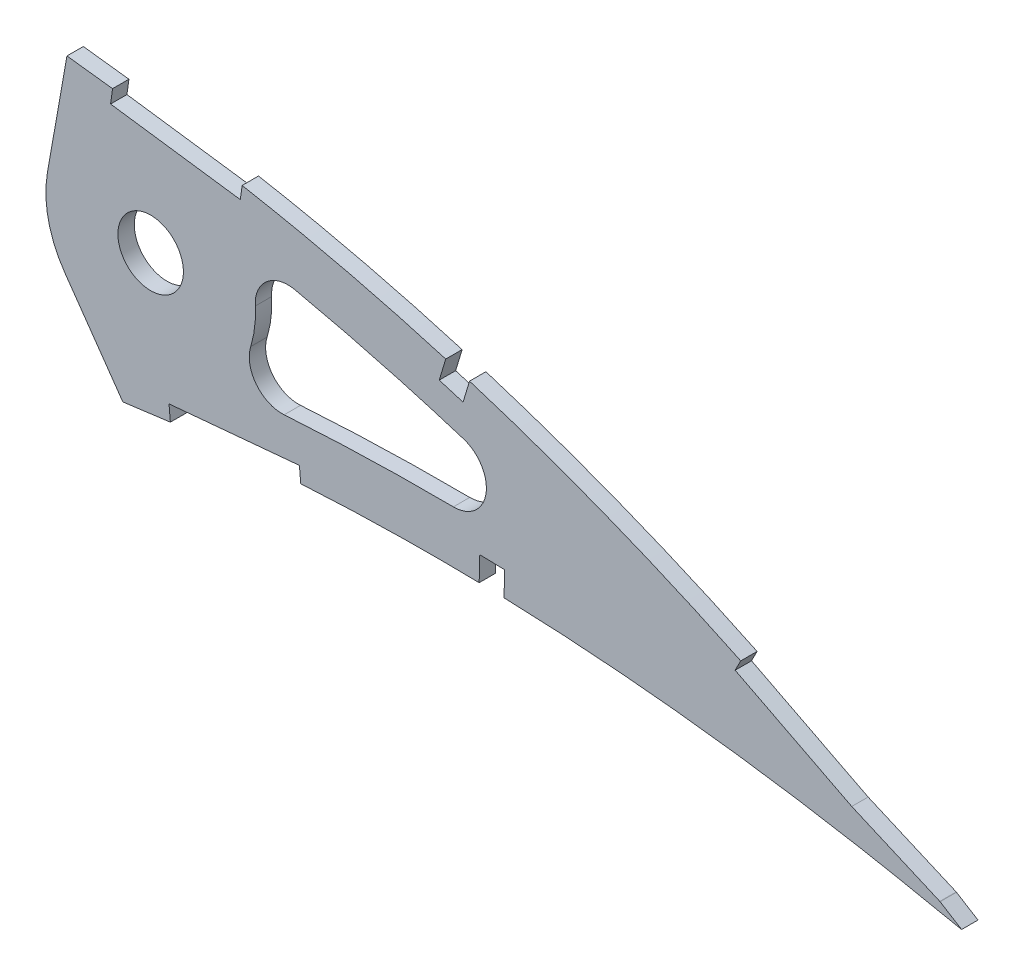
from build123d import *

# Parameters (mm, degrees)
BOSS_EXTRUDE1_DEPTH = 3.175
SKETCH4_R           = 6.35
CUT_EXTRUDE3_DEPTH  = 529.531996169
CUT_EXTRUDE4_DEPTH  = 7.62
FILLET1_R           = 6.35


with BuildPart() as part:
    # Sketch1 → Boss-Extrude1 (new body)
    with BuildSketch(Plane.XY):
        with BuildLine():
            Line((519.580178516, -0.811051185), (524.404942797, -1.768650656))
            Line((524.404942797, -1.768650656), (520.229019484, 0.811051185))
            add(Edge.make_bspline(
                [(520.229019484, 0.811051185), (520.189166605, 0.835670541), (520.029909792, 0.934052399), (519.671075297, 1.154156729), (519.073541109, 1.52075127), (518.237045599, 2.031290225), (517.162238007, 2.684417324), (515.848577801, 3.475559373), (514.296885216, 4.402146321), (512.507535633, 5.459795421), (510.480712337, 6.64355473), (508.21718701, 7.948628257), (505.717156954, 9.367627965), (502.981590452, 10.894755239), (500.011426026, 12.522747531), (496.807225449, 14.244251548), (493.37013628, 16.050511122), (489.701477824, 17.933756977), (485.801919013, 19.88358962), (481.673298347, 21.891894303), (477.316991217, 23.948657398), (472.734484625, 26.042905917), (467.928411224, 28.166102482), (462.900099753, 30.30504754), (457.652415647, 32.45047346), (452.187593096, 34.590170691), (446.508867721, 36.714394111), (440.618430338, 38.809382682), (434.52068427, 40.865980983), (428.218587641, 42.870829), (421.71664718, 44.813038248), (415.018640596, 46.680016502), (408.130151416, 48.4621889), (401.05554842, 50.146576673), (393.800827801, 51.721905645), (386.37175624, 53.178690862), (378.7745642, 54.502388693), (371.03030434, 55.691966852), (363.263579962, 56.681494561), (355.512835044, 57.651994424), (347.773632806, 58.563690257), (339.939841334, 59.436765181), (332.018997168, 60.266303487), (324.018957152, 61.049711288), (315.947820171, 61.783607472), (307.813973652, 62.465839869), (299.625288266, 63.092542591), (291.390398495, 63.662750235), (283.117445562, 64.171449818), (274.815241205, 64.618259557), (266.492213302, 65.000063177), (258.157023363, 65.314229919), (249.818522106, 65.558863312), (241.485365181, 65.731619671), (233.166575282, 65.831412809), (224.870805251, 65.855515939), (216.607073574, 65.803497941), (208.384033719, 65.673572684), (200.210713382, 65.463961556), (192.095777843, 65.174273359), (184.048002143, 64.804633746), (176.076197788, 64.351947189), (168.189012741, 63.819098613), (160.39523005, 63.203849575), (152.703412853, 62.5060365), (145.121622257, 61.728568125), (137.65829938, 60.86932984), (130.321442651, 59.930766435), (123.119077117, 58.914718085), (116.059284027, 57.820631377), (109.149625996, 56.651666482), (102.397560522, 55.409019412), (95.81023125, 54.096333304), (89.394810054, 52.713950514), (83.158087983, 51.266017865), (77.106546628, 49.75505799), (71.246691254, 48.18383703), (65.58446207, 46.556125144), (60.125584795, 44.875615234), (54.876423204, 43.144153764), (49.840944503, 41.368305654), (45.025334256, 39.549331576), (40.433281375, 37.692835265), (36.070167381, 35.80135162), (31.939251719, 33.880646801), (28.045209615, 31.932907511), (24.39081638, 29.963590665), (20.979740738, 27.975715944), (17.815266227, 25.972975661), (14.898722839, 23.96044987), (12.234131686, 21.939401784), (9.822408113, 19.914938493), (7.665078309, 17.890142748), (5.765226023, 15.866409302), (4.122782784, 13.847302025), (2.739901149, 11.834419923), (1.61682102, 9.829667672), (0.75608259, 7.834501578), (0.156832386, 5.85004365), (-0.171193188, 3.879222922), (-0.252840734, 1.920459398), (-0.084154315, 0.639196632), (0, 0)],
                knots=[0, 0, 0, 0, 0.00025409, 0.001015373, 0.002283359, 0.004056577, 0.006330982, 0.009105275, 0.012374489, 0.016134023, 0.02037966, 0.025105976, 0.030306237, 0.035972206, 0.042099522, 0.048678064, 0.055701664, 0.063160184, 0.071045824, 0.079349826, 0.08806291, 0.097175757, 0.106678112, 0.116561573, 0.126814276, 0.1374283, 0.148393618, 0.15969976, 0.171338126, 0.183297699, 0.195569604, 0.208143556, 0.221011593, 0.234161831, 0.24758745, 0.261276822, 0.27522271, 0.289414144, 0.3037712, 0.317689227, 0.331784111, 0.346039677, 0.36044387, 0.374982721, 0.389640455, 0.404403317, 0.419256601, 0.434186749, 0.449177265, 0.464214782, 0.479284009, 0.49436974, 0.509457833, 0.524532346, 0.53957932, 0.554582984, 0.569529546, 0.584403417, 0.599190992, 0.613876838, 0.628447475, 0.642888675, 0.657186054, 0.671325546, 0.685294014, 0.699078147, 0.712665095, 0.726042645, 0.739197713, 0.752117586, 0.764792042, 0.777208152, 0.789355685, 0.80122396, 0.812803686, 0.824082909, 0.835054602, 0.845709571, 0.856037853, 0.866033834, 0.875688843, 0.884997719, 0.893953426, 0.902552897, 0.910789386, 0.918660734, 0.926166253, 0.933302626, 0.94007122, 0.94647478, 0.952517526, 0.958204819, 0.963546652, 0.9685566, 0.973249913, 0.977651041, 0.981787043, 0.985694226, 0.989415109, 0.993001157, 0.996508416, 1, 1, 1, 1], degree=3))
            add(Edge.make_bspline(
                [(0, 0), (0.133592971, -0.630647919), (0.401392883, -1.8948421), (1.12897029, -3.714757932), (2.091156676, -5.464224213), (3.308146123, -7.138593951), (4.771846833, -8.737409521), (6.479026026, -10.262333902), (8.42800953, -11.712547121), (10.616246406, -13.087389262), (13.040557967, -14.388319695), (15.69821927, -15.614529628), (18.58680706, -16.765635887), (21.703174164, -17.840099654), (25.043510698, -18.839557444), (28.604640883, -19.761573512), (32.382515332, -20.607436647), (36.373500457, -21.374987622), (40.573247311, -22.065006311), (44.977392966, -22.677106427), (49.581416855, -23.211670923), (54.380802091, -23.667578066), (59.370801609, -24.045808466), (64.546441805, -24.346612989), (69.902698778, -24.570945614), (75.434441794, -24.717953346), (81.136253147, -24.789928223), (87.002979994, -24.787950681), (93.028883282, -24.711491768), (99.208815464, -24.564775433), (105.536846201, -24.346872236), (112.007262561, -24.060419153), (118.614228145, -23.708298892), (125.351817225, -23.291705179), (132.214100493, -22.812484346), (139.195119589, -22.274479418), (146.288532921, -21.679032497), (153.488154076, -21.029614162), (160.787609185, -20.329475604), (168.180591644, -19.580832593), (175.660575836, -18.787206853), (183.220899465, -17.951170059), (190.855131019, -17.077182461), (198.556296664, -16.166825422), (206.317884213, -15.225296547), (214.132591981, -14.254394805), (221.993885293, -13.257859815), (229.894693671, -12.240383742), (237.827620604, -11.201850487), (245.785993956, -10.149659277), (253.762138918, -9.082943465), (261.749112783, -8.007189221), (269.739522148, -6.925740253), (277.725584215, -5.838929488), (285.70027901, -4.751260828), (293.656208576, -3.665720235), (301.585579958, -2.582406874), (309.481219182, -1.506705212), (317.335175518, -0.438483792), (325.140206955, 0.620091626), (332.888833934, 1.665861231), (340.573746099, 2.697505345), (348.187015915, 3.714371056), (355.720983847, 4.716840325), (363.055280122, 5.674485749), (370.170740115, 6.638302095), (377.091341637, 7.428417974), (383.925772848, 8.102810237), (390.681133097, 8.655718896), (397.349310673, 9.095098533), (403.922665289, 9.424088714), (410.393362863, 9.647282626), (416.753229966, 9.771301523), (422.994322965, 9.799292754), (429.108122993, 9.740182902), (435.086678505, 9.598736647), (440.921645401, 9.381302955), (446.604883368, 9.095217537), (452.128319892, 8.748279397), (457.483662622, 8.34560601), (462.663449177, 7.896598156), (467.65968785, 7.407828642), (472.464706853, 6.884881883), (477.071494939, 6.338715544), (481.472678479, 5.77292572), (485.661637464, 5.196810252), (489.631628754, 4.616207627), (493.376364947, 4.038530197), (496.889962423, 3.469289139), (500.16674573, 2.91603967), (503.201581909, 2.38395084), (505.989204715, 1.878219093), (508.525746868, 1.40522509), (510.806198597, 0.967318665), (512.827510034, 0.571716412), (514.585922757, 0.220164109), (516.078859088, -0.082385429), (517.303711765, -0.334738039), (518.258620558, -0.532751237), (518.941699265, -0.676741413), (519.352209069, -0.762422848), (519.534603778, -0.801329602), (519.580178516, -0.811051185)],
                knots=[0, 0, 0, 0, 0.003638255, 0.007293231, 0.011028136, 0.014901081, 0.018963272, 0.023258475, 0.027820626, 0.032679082, 0.03785316, 0.043361875, 0.049214679, 0.055422346, 0.061988786, 0.068918036, 0.076211157, 0.083868392, 0.091887411, 0.100265912, 0.108999867, 0.118084529, 0.127514843, 0.13728527, 0.147387917, 0.157816481, 0.168563473, 0.179619128, 0.190977373, 0.202626974, 0.214560478, 0.226767249, 0.239236417, 0.251959004, 0.264923894, 0.278119703, 0.291536035, 0.30516028, 0.318980685, 0.332985499, 0.34716279, 0.361498603, 0.375980747, 0.390597192, 0.405332593, 0.420174823, 0.435109533, 0.450124276, 0.465203068, 0.480333154, 0.495500583, 0.510689775, 0.525887334, 0.541078314, 0.556247233, 0.571381784, 0.586466041, 0.601484516, 0.616424329, 0.631269422, 0.646006524, 0.660620684, 0.675098188, 0.689422858, 0.703581825, 0.716907564, 0.730009274, 0.742952128, 0.755725558, 0.768319952, 0.780724337, 0.792926529, 0.804916041, 0.816679084, 0.828203524, 0.8394749, 0.850481359, 0.861207697, 0.871639326, 0.881763414, 0.891563605, 0.901027364, 0.910138977, 0.918883976, 0.927249278, 0.935221104, 0.942784739, 0.949928188, 0.956638464, 0.962904203, 0.968712287, 0.974054485, 0.978918432, 0.983297219, 0.987180246, 0.990560674, 0.993433357, 0.995790625, 0.997629587, 0.998945816, 0.999736592, 1, 1, 1, 1], degree=3))
        make_face()
    extrude(amount=BOSS_EXTRUDE1_DEPTH)

    # Sketch4 → Cut-Extrude3 (cut, through all)
    with BuildSketch(Plane(origin=(0, 0, 0), x_dir=(-1, 0, 0), z_dir=(0, 0, -1))):
        with BuildLine():
            ThreePointArc((-347.130907312, 36.761105856), (-347.303865989, 28.834521931), (-350.497031314, 21.577501699))
            Line((-350.497031314, 21.577501699), (-361.749554482, 5.507233166))
            add(Edge.make_bspline(
                [(-361.749554482, 5.507233166), (-359.750002253, 5.242796176), (-355.23730571, 4.652482144), (-348.187015915, 3.714371056), (-340.573746099, 2.697505345), (-332.888833934, 1.665861231), (-325.140206955, 0.620091626), (-317.335175518, -0.438483792), (-309.481219182, -1.506705212), (-301.585579958, -2.582406874), (-293.656208576, -3.665720235), (-285.70027901, -4.751260828), (-277.725584215, -5.838929488), (-269.739522148, -6.925740253), (-261.749112783, -8.007189221), (-253.762138918, -9.082943465), (-245.785993956, -10.149659277), (-237.827620604, -11.201850487), (-229.894693671, -12.240383742), (-221.993885293, -13.257859815), (-214.132591981, -14.254394805), (-206.317884213, -15.225296547), (-198.556296664, -16.166825422), (-190.855131019, -17.077182461), (-183.220899465, -17.951170059), (-175.660575836, -18.787206853), (-168.180591644, -19.580832593), (-160.787609185, -20.329475604), (-153.488154076, -21.029614162), (-146.288532921, -21.679032497), (-139.195119589, -22.274479418), (-132.214100493, -22.812484346), (-125.351817225, -23.291705179), (-118.614228145, -23.708298892), (-112.007262561, -24.060419153), (-105.536846201, -24.346872236), (-99.208815464, -24.564775433), (-93.028883282, -24.711491768), (-87.002979994, -24.787950681), (-81.136253147, -24.789928223), (-75.434441794, -24.717953346), (-69.902698778, -24.570945614), (-64.546441805, -24.346612989), (-59.370801609, -24.045808466), (-54.380802091, -23.667578066), (-49.581416855, -23.211670923), (-44.977392966, -22.677106427), (-40.573247311, -22.065006311), (-36.373500457, -21.374987622), (-32.382515332, -20.607436647), (-28.604640883, -19.761573512), (-25.043510698, -18.839557444), (-21.703174164, -17.840099654), (-18.58680706, -16.765635887), (-15.69821927, -15.614529628), (-13.040557967, -14.388319695), (-10.616246406, -13.087389262), (-8.42800953, -11.712547121), (-6.479026026, -10.262333902), (-4.771846833, -8.737409521), (-3.308146123, -7.138593951), (-2.091156676, -5.464224213), (-1.12897029, -3.714757932), (-0.401392883, -1.8948421), (-0.133592971, -0.630647919), (0, 0)],
                knots=[0.299176266, 0.299176266, 0.299176266, 0.299176266, 0.310577142, 0.324901812, 0.339379316, 0.353993476, 0.368730578, 0.383575671, 0.398515484, 0.413533959, 0.428618216, 0.443752767, 0.458921686, 0.474112666, 0.489310225, 0.504499417, 0.519666846, 0.534796932, 0.549875724, 0.564890467, 0.579825177, 0.594667407, 0.609402808, 0.624019253, 0.638501397, 0.65283721, 0.667014501, 0.681019315, 0.69483972, 0.708463965, 0.721880297, 0.735076106, 0.748040996, 0.760763583, 0.773232751, 0.785439522, 0.797373026, 0.809022627, 0.820380872, 0.831436527, 0.842183519, 0.852612083, 0.86271473, 0.872485157, 0.881915471, 0.891000133, 0.899734088, 0.908112589, 0.916131608, 0.923788843, 0.931081964, 0.938011214, 0.944577654, 0.950785321, 0.956638125, 0.96214684, 0.967320918, 0.972179374, 0.976741525, 0.981036728, 0.985098919, 0.988971864, 0.992706769, 0.996361745, 1, 1, 1, 1], degree=3))
            add(Edge.make_bspline(
                [(0, 0), (0.084154315, 0.639196632), (0.252840734, 1.920459398), (0.171193188, 3.879222922), (-0.156832386, 5.85004365), (-0.75608259, 7.834501578), (-1.61682102, 9.829667672), (-2.739901149, 11.834419923), (-4.122782784, 13.847302025), (-5.765226023, 15.866409302), (-7.665078309, 17.890142748), (-9.822408113, 19.914938493), (-12.234131686, 21.939401784), (-14.898722839, 23.96044987), (-17.815266227, 25.972975661), (-20.979740738, 27.975715944), (-24.39081638, 29.963590665), (-28.045209615, 31.932907511), (-31.939251719, 33.880646801), (-36.070167381, 35.80135162), (-40.433281375, 37.692835265), (-45.025334256, 39.549331576), (-49.840944503, 41.368305654), (-54.876423204, 43.144153764), (-60.125584795, 44.875615234), (-65.58446207, 46.556125144), (-71.246691254, 48.18383703), (-77.106546628, 49.75505799), (-83.158087983, 51.266017865), (-89.394810054, 52.713950514), (-95.81023125, 54.096333304), (-102.397560522, 55.409019412), (-109.149625996, 56.651666482), (-116.059284027, 57.820631377), (-123.119077117, 58.914718085), (-130.321442651, 59.930766435), (-137.65829938, 60.86932984), (-145.121622257, 61.728568125), (-152.703412853, 62.5060365), (-160.39523005, 63.203849575), (-168.189012741, 63.819098613), (-176.076197788, 64.351947189), (-184.048002143, 64.804633746), (-192.095777843, 65.174273359), (-200.210713382, 65.463961556), (-208.384033719, 65.673572684), (-216.607073574, 65.803497941), (-224.870805251, 65.855515939), (-233.166575282, 65.831412809), (-241.485365181, 65.731619671), (-249.818522106, 65.558863312), (-258.157023363, 65.314229919), (-266.492213302, 65.000063177), (-274.815241205, 64.618259557), (-283.117445562, 64.171449818), (-291.390398495, 63.662750235), (-299.625288266, 63.092542591), (-307.813973652, 62.465839869), (-315.947820171, 61.783607472), (-324.018957152, 61.049711288), (-332.018997168, 60.266303487), (-339.939841334, 59.436765181), (-346.227461312, 58.736010846), (-349.87402552, 58.313335631), (-350.909730833, 58.191878985)],
                knots=[0, 0, 0, 0, 0.003491584, 0.006998843, 0.010584891, 0.014305774, 0.018212957, 0.022348959, 0.026750087, 0.0314434, 0.036453348, 0.041795181, 0.047482474, 0.05352522, 0.05992878, 0.066697374, 0.073833747, 0.081339266, 0.089210614, 0.097447103, 0.106046574, 0.115002281, 0.124311157, 0.133966166, 0.143962147, 0.154290429, 0.164945398, 0.175917091, 0.187196314, 0.19877604, 0.210644315, 0.222791848, 0.235207958, 0.247882414, 0.260802287, 0.273957355, 0.287334905, 0.300921853, 0.314705986, 0.328674454, 0.342813946, 0.357111325, 0.371552525, 0.386123162, 0.400809008, 0.415596583, 0.430470454, 0.445417016, 0.46042068, 0.475467654, 0.490542167, 0.50563026, 0.520715991, 0.535785218, 0.550822735, 0.565813251, 0.580743399, 0.595596683, 0.610359545, 0.625017279, 0.63955613, 0.653960323, 0.668215889, 0.673872202, 0.673872202, 0.673872202, 0.673872202], degree=3))
            Line((-350.909730833, 58.191878985), (-347.130907312, 36.761105856))
        make_face()
        with Locations((-367.142200854, 33.232574886)):
            Circle(SKETCH4_R)
        with BuildLine():
            ThreePointArc((-387.462200854, 33.232574886), (-386.814379612, 38.322543737), (-384.912222221, 43.087966334))
            add(Edge.make_bspline(
                [(-384.912222221, 43.087966334), (-386.818824475, 42.732614345), (-394.210424123, 41.294453801), (-407.028210468, 38.374212868), (-428.620355258, 32.39115288), (-448.413992243, 25.407269546), (-462.57734912, 19.420041956), (-466.382547126, 17.738579891)],
                knots=[0.739380826, 0.739380826, 0.739380826, 0.739380826, 0.750199071, 0.781424187, 0.812649303, 0.875099535, 0.898258577, 0.898258577, 0.898258577, 0.898258577], degree=3))
            add(Edge.make_bspline(
                [(-466.382547126, 17.738579891), (-462.513007229, 18.118917697), (-447.384629134, 19.418402411), (-426.536653446, 20.177211731), (-403.909109388, 19.686350489), (-390.476664545, 18.867911853), (-382.696670013, 18.178863487), (-380.561422835, 17.973909105)],
                knots=[0.103390506, 0.103390506, 0.103390506, 0.103390506, 0.124896322, 0.187344483, 0.218568563, 0.249792644, 0.26163416, 0.26163416, 0.26163416, 0.26163416], degree=3))
            ThreePointArc((-380.561422835, 17.973909105), (-385.656803073, 24.859289708), (-387.462200854, 33.232574886))
        make_face()
    extrude(amount=-CUT_EXTRUDE3_DEPTH, mode=Mode.SUBTRACT)

    # Sketch5 → Cut-Extrude4 (cut)
    with BuildSketch(Plane.XY.offset(3.175)):
        Polygon((384.961328648, 54.016498288), (359.803806164, 57.490736253), (359.369526419, 54.346045943), (384.527048903, 50.871807978), align=None)
        Polygon((395.984366342, 11.965923207), (370.698815929, 9.653682873), (370.98784597, 6.492989071), (396.273396384, 8.805229405), align=None)
        Polygon((429.117858019, 43.070336902), (424.499319283, 44.464099147), (423.105557039, 39.845560411), (427.724095775, 38.451798166), align=None)
        Polygon((435.786991484, 14.341315593), (430.963938334, 14.459159398), (430.846094529, 9.636106247), (435.66914768, 9.518262443), align=None)
        Polygon((504.452510222, 11.115204058), (481.935027394, 22.642294806), (480.48827192, 19.816144458), (503.097474702, 8.242100672), (526.404447181, -1.854547191), (527.666528163, 1.058824369), align=None)
    extrude(amount=-CUT_EXTRUDE4_DEPTH, mode=Mode.SUBTRACT)

    # Fillet1
    fillet1_edges = [part.edges().sort_by_distance(p)[0] for p in [
        (466.382547126, 17.738579891, 1.5875),
        (380.561422835, 17.973909105, 1.5875),
        (384.912222221, 43.087966334, 1.5875),
    ]]
    fillet(fillet1_edges, radius=FILLET1_R)


solid = part.part
